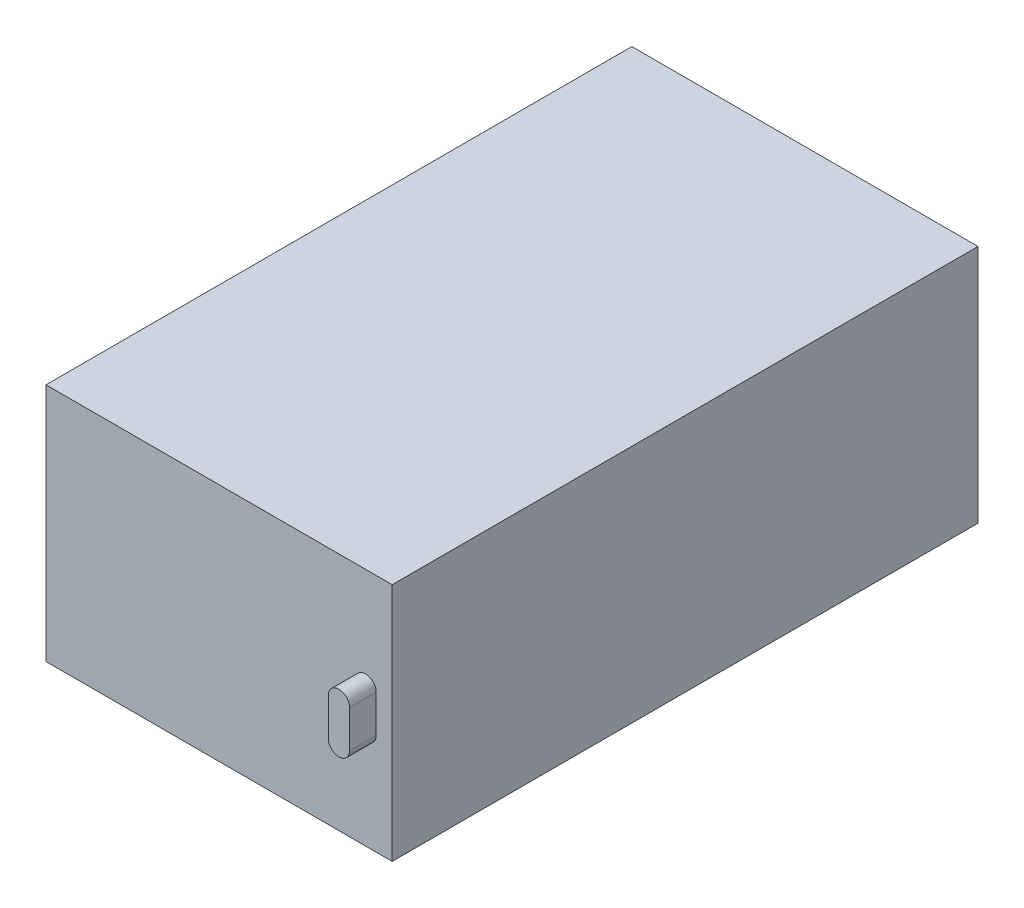
from build123d import *

# Parameters (mm, degrees)
SKETCH_1_W      = 220
SKETCH_1_H      = 90
EXTRUDE_1_DEPTH = 130
EXTRUDE_2_DEPTH = 10


with BuildPart() as part:
    # Эскиз1 → Бобышка-Вытянуть1 (new body)
    with BuildSketch(Plane(origin=(0, 0, 0), x_dir=(0, 0, -1), z_dir=(1, 0, 0))):
        with Locations((110, 45)):
            Rectangle(SKETCH_1_W, SKETCH_1_H)
    extrude(amount=-EXTRUDE_1_DEPTH)

    # Эскиз2 → Бобышка-Вытянуть2 (add)
    with BuildSketch(Plane.XY):
        with BuildLine():
            Line((-14, 38), (-14, 52))
            ThreePointArc((-14, 52), (-10, 56), (-6, 52))
            Line((-6, 52), (-6, 38))
            ThreePointArc((-6, 38), (-10, 34), (-14, 38))
        make_face()
    extrude(amount=EXTRUDE_2_DEPTH)


solid = part.part
